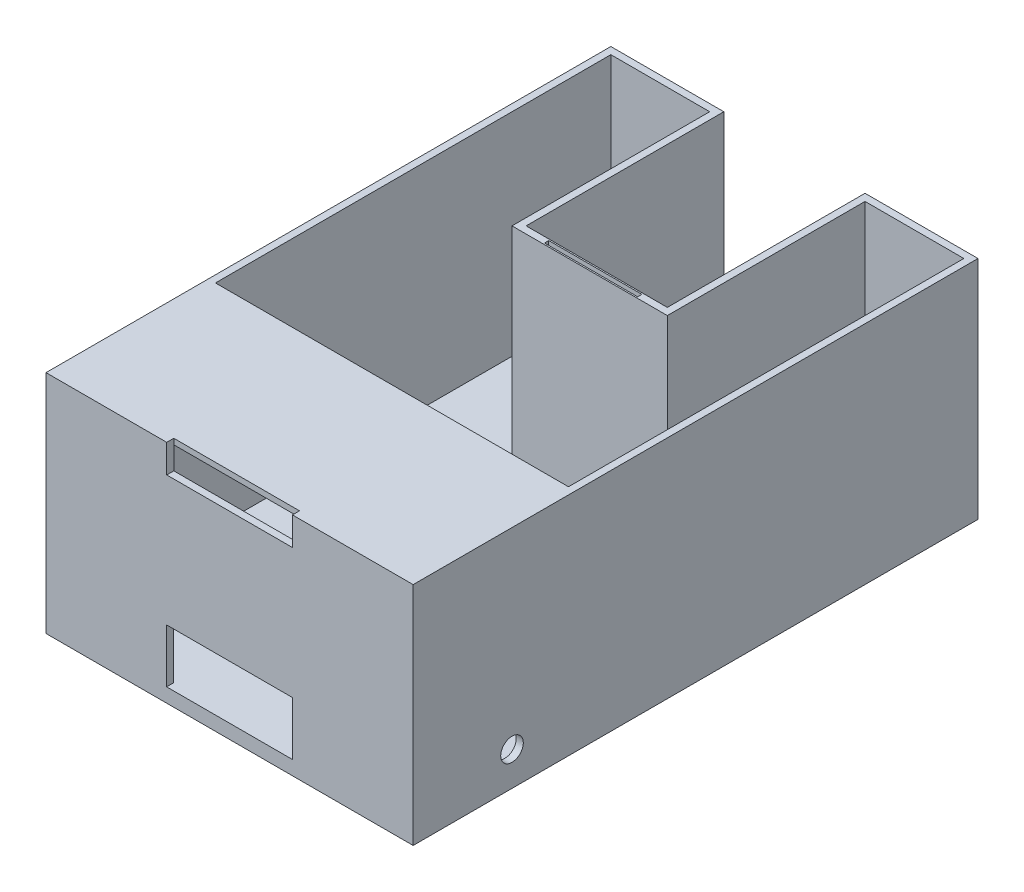
from build123d import *

# Parameters (mm, degrees)
BOSS_EXTRUDE2_DEPTH  = 5
BOSS_EXTRUDE3_DEPTH  = 75
CUT_EXTRUDE7_DEPTH   = 10
SKETCH22_W           = 130
SKETCH22_H           = 2
BOSS_EXTRUDE7_DEPTH  = 55
CUT_EXTRUDE8_REACH   = 253.595
SKETCH23_W           = 44.6
SKETCH23_H           = 19
SKETCH24_R           = 4
CUT_EXTRUDE10_DEPTH  = 252.594912508
SKETCH25_W           = 33
SKETCH25_H           = 1.5
CUT_EXTRUDE11_DEPTH  = 15
BOSS_EXTRUDE16_DEPTH = 50


with BuildPart() as part:
    # Sketch1 → Boss-Extrude2 (new body)
    with BuildSketch(Plane(origin=(0, 0, 0), x_dir=(1, 0, 0), z_dir=(0, 1, 0))):
        Polygon((-130, 0), (0, 0), (0, 200), (-40, 200), (-40, 130), (-90, 130), (-90, 200), (-130, 200), align=None)
    extrude(amount=BOSS_EXTRUDE2_DEPTH)

    # Sketch2 → Boss-Extrude3 (add)
    with BuildSketch(Plane(origin=(0, 5, 0), x_dir=(1, 0, 0), z_dir=(0, 1, 0))):
        Polygon((-130, 0), (0, 0), (0, 200), (-40, 200), (-40, 130), (-90, 130), (-90, 200), (-130, 200), align=None)
        Polygon((-92.5, 197.5), (-127.5, 197.5), (-127.5, 2.5), (-2.5, 2.5), (-2.5, 197.5), (-37.5, 197.5), (-37.5, 127.5), (-92.5, 127.5), align=None, mode=Mode.SUBTRACT)
    extrude(amount=BOSS_EXTRUDE3_DEPTH)

    # Sketch20 → Cut-Extrude7 (cut)
    with BuildSketch(Plane(origin=(0, 80, 0), x_dir=(1, 0, 0), z_dir=(0, 1, 0))):
        Polygon((-65, 0), (-87.25, 0), (-87.25, 12), (-42.75, 12), (-42.75, 0), align=None)
    extrude(amount=-CUT_EXTRUDE7_DEPTH, mode=Mode.SUBTRACT)

    # Sketch22 → Boss-Extrude7 (add)
    with BuildSketch(Plane(origin=(0, 0, -2.5), x_dir=(-1, 0, 0), z_dir=(0, 0, -1))):
        with Locations((65, 79)):
            Rectangle(SKETCH22_W, SKETCH22_H)
    extrude(amount=BOSS_EXTRUDE7_DEPTH)

    # Sketch23 → Cut-Extrude8 (cut, up to next)
    with BuildSketch(Plane.XY, mode=Mode.PRIVATE) as cut_extrude8_sk1:
        with Locations((-65, 14.5)):
            Rectangle(SKETCH23_W, SKETCH23_H)
    cut_extrude8_tool1 = extrude(cut_extrude8_sk1.sketch, amount=-CUT_EXTRUDE8_REACH, mode=Mode.PRIVATE) & part.part
    add(cut_extrude8_tool1.solids().sort_by_distance((-65, 14.5, 0))[0], mode=Mode.SUBTRACT)

    # Sketch24 → Cut-Extrude10 (cut, through all)
    with BuildSketch(Plane.ZY.offset(130)):
        with Locations((-35, 12)):
            Circle(SKETCH24_R)
    extrude(amount=-CUT_EXTRUDE10_DEPTH, mode=Mode.SUBTRACT)

    # Sketch25 → Cut-Extrude11 (cut)
    with BuildSketch(Plane(origin=(0, 80, 0), x_dir=(1, 0, 0), z_dir=(0, 1, 0))):
        with Locations((-65, 128.75)):
            Rectangle(SKETCH25_W, SKETCH25_H)
    extrude(amount=-CUT_EXTRUDE11_DEPTH, mode=Mode.SUBTRACT)


with BuildPart() as body_2:
    # Sketch37 → Boss-Extrude16 (new body)
    with BuildSketch(Plane(origin=(-90, 0, 0), x_dir=(0, 0, -1), z_dir=(1, 0, 0))):
        with BuildLine():
            Line((130, 80), (130, -13))
            Line((130, -13), (205.60928057, -13))
            ThreePointArc((205.60928057, -13), (151.287320135, 20.071368887), (130, 80))
        make_face()
    extrude(amount=BOSS_EXTRUDE16_DEPTH)


solid = Compound([part.part, body_2.part])
